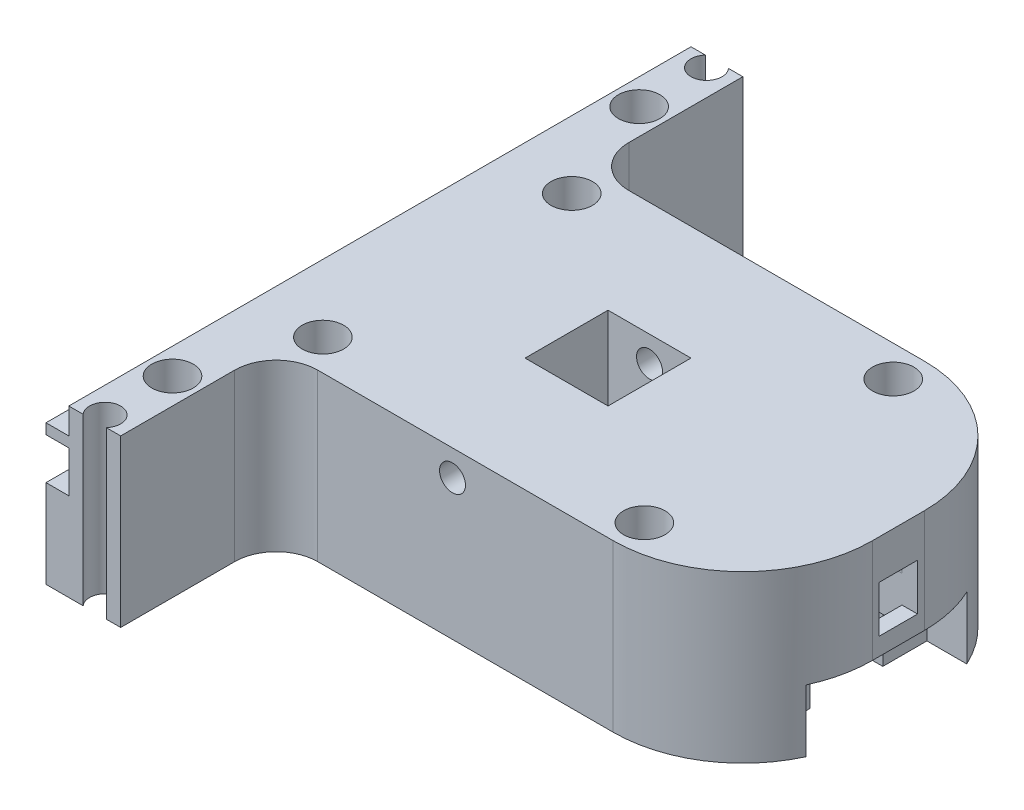
from build123d import *

# Parameters (mm, degrees)
SKETCH1_W           = 18.288
SKETCH1_H           = 40.64
BOSS_EXTRUDE1_DEPTH = 152.4
SKETCH2_W           = 5.588
SKETCH2_H           = 6.35
SKETCH2_H_2         = 10.16
CUT_EXTRUDE1_DEPTH  = 152.4
SKETCH3_R           = 5.08
CUT_EXTRUDE2_DEPTH  = 15.24
LPATTERN1_COUNT     = 4
LPATTERN1_PITCH     = 38.1
SKETCH4_R           = 2.032
CUT_EXTRUDE3_DEPTH  = 159.782305513
LPATTERN2_COUNT     = 4
LPATTERN2_PITCH     = 38.1
SKETCH5_W           = 76.2
SKETCH5_H           = 40.64
BOSS_EXTRUDE2_DEPTH = 114.3
SKETCH6_W           = 101.6
SKETCH6_H           = 76.2
BOSS_EXTRUDE3_DEPTH = 22.86
SKETCH8_R           = 3.81
CUT_EXTRUDE5_DEPTH  = 207.050836795
FILLET3_R           = 10.16
FILLET4_R           = 31.75
SKETCH16_W          = 76.2
SKETCH16_H          = 22.86
CUT_EXTRUDE13_DEPTH = 194.857086535
SKETCH18_W          = 20.32
SKETCH18_H          = 20.32
CUT_EXTRUDE14_DEPTH = 207.050836795
SKETCH19_W          = 39.37
SKETCH19_H          = 15.24
CUT_EXTRUDE15_DEPTH = 12.7
SKETCH20_W          = 38.1
SKETCH20_H          = 17.78
CUT_EXTRUDE16_DEPTH = 15.24
SKETCH21_W          = 13.97
SKETCH21_H          = 7.62
CUT_EXTRUDE17_DEPTH = 15.24
FILLET5_R           = 10.16
SKETCH22_W          = 9.398
SKETCH22_H          = 11.43
CUT_EXTRUDE18_DEPTH = 3.81
CUT_EXTRUDE19_DEPTH = 12.7
SKETCH25_W          = 9.398
SKETCH25_H          = 11.049
FILLET6_R           = 12.7
FILLET7_R           = 12.7
SKETCH26_R          = 5.08
CUT_EXTRUDE20_DEPTH = 15.24
SKETCH27_R          = 2.032
CUT_EXTRUDE21_DEPTH = 207.050836795
FILLET8_R           = 10.16
SKETCH29_R          = 3.175
CUT_EXTRUDE22_DEPTH = 180.70998134


with BuildPart() as part:
    # Sketch1 → Boss-Extrude1 (new body)
    with BuildSketch(Plane.XY):
        with Locations((9.144, 20.32)):
            Rectangle(SKETCH1_W, SKETCH1_H)
    extrude(amount=BOSS_EXTRUDE1_DEPTH)

    # Sketch2 → Cut-Extrude1 (cut)
    with BuildSketch(Plane(origin=(0, 0, 0), x_dir=(-1, 0, 0), z_dir=(0, 0, -1))):
        with Locations((-2.794, 37.465)):
            Rectangle(SKETCH2_W, SKETCH2_H)
        with Locations((-2.794, 26.67)):
            Rectangle(SKETCH2_W, SKETCH2_H_2)
    extrude(amount=-CUT_EXTRUDE1_DEPTH, mode=Mode.SUBTRACT)

    # Sketch3 → Cut-Extrude2 (cut)
    with BuildSketch(Plane(origin=(0, 40.64, 0), x_dir=(1, 0, 0), z_dir=(0, 1, 0))):
        with Locations(Location((11.938, -19.05, 0), (0, 0, 270))):
            Circle(SKETCH3_R)
    cut_extrude2 = extrude(amount=-CUT_EXTRUDE2_DEPTH, mode=Mode.SUBTRACT)

    # LPattern1: Cut-Extrude2 ×4, 2 skipped
    with Locations(*[(0, 0, i * LPATTERN1_PITCH) for i in range(1, LPATTERN1_COUNT) if i not in (1, 2)]):
        add(cut_extrude2, mode=Mode.SUBTRACT)

    # Sketch4 → Cut-Extrude3 (cut, through all)
    with BuildSketch(Plane(origin=(0, 40.64, 0), x_dir=(1, 0, 0), z_dir=(0, 1, 0))):
        with Locations(Location((11.938, -19.05, 0), (0, 0, 270))):
            Circle(SKETCH4_R)
    cut_extrude3 = extrude(amount=-CUT_EXTRUDE3_DEPTH, mode=Mode.SUBTRACT)

    # LPattern2: Cut-Extrude3 ×4, 2 skipped
    with Locations(*[(0, 0, i * LPATTERN2_PITCH) for i in range(1, LPATTERN2_COUNT) if i not in (1, 2)]):
        add(cut_extrude3, mode=Mode.SUBTRACT)

    # Sketch5 → Boss-Extrude2 (add)
    with BuildSketch(Plane(origin=(18.288, 0, 0), x_dir=(0, 0, -1), z_dir=(1, 0, 0))):
        with Locations((-76.2, 20.32)):
            Rectangle(SKETCH5_W, SKETCH5_H)
    extrude(amount=BOSS_EXTRUDE2_DEPTH)

    # Sketch6 → Boss-Extrude3 (add)
    with BuildSketch(Plane(origin=(0, 40.64, 0), x_dir=(1, 0, 0), z_dir=(0, 1, 0))):
        with Locations((81.788, -76.2)):
            Rectangle(SKETCH6_W, SKETCH6_H)
    extrude(amount=BOSS_EXTRUDE3_DEPTH)

    # Sketch8 → Cut-Extrude5 (cut, through all)
    with BuildSketch(Plane(origin=(0, 40.64, 0), x_dir=(1, 0, 0), z_dir=(0, 1, 0))):
        with Locations((11.938, -149.86)):
            Circle(SKETCH8_R)
        with Locations((11.938, -2.54)):
            Circle(SKETCH8_R)
    extrude(amount=-CUT_EXTRUDE5_DEPTH, mode=Mode.SUBTRACT)

    # Fillet3
    fillet3_edges = [part.edges().sort_by_distance(p)[0] for p in [
        (18.288, 20.32, 114.3),
        (18.288, 20.32, 38.1),
    ]]
    fillet(fillet3_edges, radius=FILLET3_R)

    # Fillet4
    fillet4_edges = [part.edges().sort_by_distance(p)[0] for p in [
        (132.588, 31.75, 114.3),
        (132.588, 31.75, 38.1),
    ]]
    fillet(fillet4_edges, radius=FILLET4_R)

    # Sketch16 → Cut-Extrude13 (cut, through all)
    with BuildSketch(Plane.ZY.offset(-30.988)):
        with Locations((76.2, 52.07)):
            Rectangle(SKETCH16_W, SKETCH16_H)
    extrude(amount=-CUT_EXTRUDE13_DEPTH, mode=Mode.SUBTRACT)

    # Sketch18 → Cut-Extrude14 (cut, through all)
    with BuildSketch(Plane(origin=(0, 40.64, 0), x_dir=(1, 0, 0), z_dir=(0, 1, 0))):
        with Locations((61.468, -76.2)):
            Rectangle(SKETCH18_W, SKETCH18_H)
    extrude(amount=-CUT_EXTRUDE14_DEPTH, mode=Mode.SUBTRACT)

    # Sketch19 → Cut-Extrude15 (cut)
    with BuildSketch(Plane(origin=(132.588, 0, 0), x_dir=(0, 0, -1), z_dir=(1, 0, 0))):
        with Locations((-76.2, 7.62)):
            Rectangle(SKETCH19_W, SKETCH19_H)
    extrude(amount=-CUT_EXTRUDE15_DEPTH, mode=Mode.SUBTRACT)

    # Sketch20 → Cut-Extrude16 (cut)
    with BuildSketch(Plane.XZ):
        with Locations((100.838, 76.2)):
            Rectangle(SKETCH20_W, SKETCH20_H)
    extrude(amount=-CUT_EXTRUDE16_DEPTH, mode=Mode.SUBTRACT)

    # Sketch21 → Cut-Extrude17 (cut)
    with BuildSketch(Plane.XZ):
        Polygon((0, 92.71), (81.788, 92.71), (95.758, 92.71), (95.758, 102.87), (0, 102.87), align=None)
        with Locations((88.773, 88.9)):
            Rectangle(SKETCH21_W, SKETCH21_H)
    extrude(amount=-CUT_EXTRUDE17_DEPTH, mode=Mode.SUBTRACT)

    # Fillet5
    fillet5_edges = [part.edges().sort_by_distance(p)[0] for p in [
        (81.788, 7.62, 67.31),
        (95.758, 7.62, 102.87),
        (81.788, 7.62, 92.71),
    ]]
    fillet(fillet5_edges, radius=FILLET5_R)

    # Sketch22 → Cut-Extrude18 (cut)
    with BuildSketch(Plane(origin=(132.588, 0, 0), x_dir=(0, 0, -1), z_dir=(1, 0, 0))):
        with Locations((-76.2, 25.273)):
            Rectangle(SKETCH22_W, SKETCH22_H)
    extrude(amount=-CUT_EXTRUDE18_DEPTH, mode=Mode.SUBTRACT)

    # Sketch23 → Cut-Extrude19 (cut)
    with BuildSketch(Plane(origin=(128.778, 0, 0), x_dir=(0, 0, -1), z_dir=(1, 0, 0))):
        with BuildLine():
            Line((-71.501, 19.558), (-71.501, 26.289))
            ThreePointArc((-71.501, 26.289), (-72.877305235, 22.966305235), (-76.2, 21.59))
            Line((-76.2, 21.59), (-76.2, 19.558))
            Line((-76.2, 19.558), (-71.501, 19.558))
        make_face()
        with BuildLine():
            ThreePointArc((-71.501, 26.289), (-72.877305235, 29.611694765), (-76.2, 30.988))
            Line((-76.2, 30.988), (-76.2, 26.289))
            Line((-76.2, 26.289), (-71.501, 26.289))
        make_face()
        with BuildLine():
            Line((-76.2, 26.289), (-76.2, 30.988))
            ThreePointArc((-76.2, 30.988), (-79.522694765, 29.611694765), (-80.899, 26.289))
            Line((-80.899, 26.289), (-76.2, 26.289))
        make_face()
        with BuildLine():
            Line((-71.501, 26.289), (-76.2, 26.289))
            Line((-76.2, 26.289), (-76.2, 21.59))
            ThreePointArc((-76.2, 21.59), (-72.877305235, 22.966305235), (-71.501, 26.289))
        make_face()
        with BuildLine():
            Line((-76.2, 21.59), (-76.2, 26.289))
            Line((-76.2, 26.289), (-80.899, 26.289))
            ThreePointArc((-80.899, 26.289), (-79.522694765, 22.966305235), (-76.2, 21.59))
        make_face()
        with BuildLine():
            ThreePointArc((-76.2, 21.59), (-79.522694765, 22.966305235), (-80.899, 26.289))
            Line((-80.899, 26.289), (-80.899, 19.558))
            Line((-80.899, 19.558), (-76.2, 19.558))
            Line((-76.2, 19.558), (-76.2, 21.59))
        make_face()
        Polygon((-71.501, 9.779), (-71.501, 19.558), (-76.2, 19.558), (-80.899, 19.558), (-80.899, 9.779), align=None)
    extrude(amount=-CUT_EXTRUDE19_DEPTH, mode=Mode.SUBTRACT)

    # Sketch25 → Cut-Revolve1 (revolve, cut)
    with BuildSketch(Plane(origin=(116.078, 0, 0), x_dir=(0, 0, -1), z_dir=(1, 0, 0))):
        with Locations((-76.2, 20.7645)):
            Rectangle(SKETCH25_W, SKETCH25_H)
    revolve(axis=Axis((116.078, 15.24, 80.899), (0, 0, -1)), mode=Mode.SUBTRACT)

    # Fillet6
    fillet6_edges = [part.edges().sort_by_distance(p)[0] for p in [
        (105.029, 15.24, 76.2),
    ]]
    fillet(fillet6_edges, radius=FILLET6_R)

    # Fillet7
    # the kernel refuses this fillet: 12.7 mm, written as the material it takes off along each edge
    with BuildSketch(Plane(origin=(0, 15.24, 102.87), x_dir=(1, 0, 0), z_dir=(0, 0, -1))) as fillet7_piece_1:
        with BuildLine():
            CenterArc((FILLET7_R, -FILLET7_R), FILLET7_R, 90, 90)
            Line((0, -FILLET7_R), (0, 0))
            Line((0, 0), (FILLET7_R, 0))
        make_face()
    extrude(amount=10.16, mode=Mode.SUBTRACT)
    with BuildSketch(Plane(origin=(0, -31.75, 92.71), x_dir=(0, 0, -1), z_dir=(0, 1, 0))) as fillet7_piece_2:
        with BuildLine():
            CenterArc((FILLET7_R, -FILLET7_R), FILLET7_R, 90, 90)
            Line((0, -FILLET7_R), (0, 0))
            Line((0, 0), (FILLET7_R, 0))
        make_face()
    extrude(amount=46.99, mode=Mode.SUBTRACT)
    with BuildSketch(Plane(origin=(0, -31.75, 102.87), x_dir=(0, 0, 1), z_dir=(0, 1, 0))) as fillet7_piece_3:
        with BuildLine():
            CenterArc((FILLET7_R, FILLET7_R), FILLET7_R, 180, 90)
            Line((0, FILLET7_R), (0, 0))
            Line((0, 0), (FILLET7_R, 0))
        make_face()
    extrude(amount=46.99, mode=Mode.SUBTRACT)
    with BuildSketch(Plane(origin=(0, 15.24, 134.62), x_dir=(1, 0, 0), z_dir=(0, 0, -1))) as fillet7_piece_4a_section:
        with BuildLine():
            CenterArc((FILLET7_R, -FILLET7_R), FILLET7_R, 90, 90)
            Line((0, -FILLET7_R), (0, 0))
            Line((0, 0), (FILLET7_R, 0))
        make_face()
    fillet7_piece_4a = extrude(amount=41.91, mode=Mode.PRIVATE)
    fillet7_piece_4a = split(fillet7_piece_4a, bisect_by=Plane(origin=(2.875217951, 18.115217951, 102.87), z_dir=(0, 0, 1)), keep=Keep.TOP, mode=Mode.PRIVATE)
    with BuildSketch(Plane(origin=(0, -31.75, 102.87), x_dir=(0, 0, 1), z_dir=(0, 1, 0))) as fillet7_piece_4b_section:
        with BuildLine():
            CenterArc((FILLET7_R, FILLET7_R), FILLET7_R, 180, 90)
            Line((0, FILLET7_R), (0, 0))
            Line((0, 0), (FILLET7_R, 0))
        make_face()
    fillet7_piece_4b = extrude(amount=78.74, mode=Mode.PRIVATE)
    fillet7_piece_4b = split(fillet7_piece_4b, bisect_by=Plane(origin=(2.875217951, 15.24, 105.745217951), z_dir=(0, 1, 0)), keep=Keep.TOP, mode=Mode.PRIVATE)
    fillet7_piece_4 = fillet7_piece_4a & fillet7_piece_4b
    add(fillet7_piece_4, mode=Mode.SUBTRACT)
    with BuildSketch(Plane(origin=(0, 15.24, 102.87), x_dir=(1, 0, 0), z_dir=(0, 0, -1))) as fillet7_piece_5a_section:
        with BuildLine():
            CenterArc((FILLET7_R, -FILLET7_R), FILLET7_R, 90, 90)
            Line((0, -FILLET7_R), (0, 0))
            Line((0, 0), (FILLET7_R, 0))
        make_face()
    fillet7_piece_5a = extrude(amount=41.91, mode=Mode.PRIVATE)
    fillet7_piece_5a = split(fillet7_piece_5a, bisect_by=Plane(origin=(2.875217951, 18.115217951, 92.71), z_dir=(0, 0, -1)), keep=Keep.TOP, mode=Mode.PRIVATE)
    with BuildSketch(Plane(origin=(0, -31.75, 92.71), x_dir=(0, 0, -1), z_dir=(0, 1, 0))) as fillet7_piece_5b_section:
        with BuildLine():
            CenterArc((FILLET7_R, -FILLET7_R), FILLET7_R, 90, 90)
            Line((0, -FILLET7_R), (0, 0))
            Line((0, 0), (FILLET7_R, 0))
        make_face()
    fillet7_piece_5b = extrude(amount=78.74, mode=Mode.PRIVATE)
    fillet7_piece_5b = split(fillet7_piece_5b, bisect_by=Plane(origin=(2.875217951, 15.24, 89.834782049), z_dir=(0, 1, 0)), keep=Keep.TOP, mode=Mode.PRIVATE)
    fillet7_piece_5 = fillet7_piece_5a & fillet7_piece_5b
    add(fillet7_piece_5, mode=Mode.SUBTRACT)

    # Sketch26 → Cut-Extrude20 (cut)
    with BuildSketch(Plane(origin=(0, 40.64, 0), x_dir=(1, 0, 0), z_dir=(0, 1, 0))):
        with Locations(Location((100.838, -106.68, 0), (0, 0, 270))):
            Circle(SKETCH26_R)
        with Locations(Location((100.838, -45.72, 0), (0, 0, 270))):
            Circle(SKETCH26_R)
    cut_extrude20 = extrude(amount=-CUT_EXTRUDE20_DEPTH, mode=Mode.SUBTRACT)

    # Sketch27 → Cut-Extrude21 (cut, through all)
    with BuildSketch(Plane(origin=(0, 40.64, 0), x_dir=(1, 0, 0), z_dir=(0, 1, 0))):
        with Locations(Location((100.838, -106.68, 0), (0, 0, 270))):
            Circle(SKETCH27_R)
        with Locations(Location((100.838, -45.72, 0), (0, 0, 270))):
            Circle(SKETCH27_R)
    cut_extrude21 = extrude(amount=-CUT_EXTRUDE21_DEPTH, mode=Mode.SUBTRACT)

    # Mirror1: Cut-Extrude20, Cut-Extrude21 across plane
    add(cut_extrude20.mirror(Plane.ZY.offset(-61.468)), mode=Mode.SUBTRACT)
    add(cut_extrude21.mirror(Plane.ZY.offset(-61.468)), mode=Mode.SUBTRACT)

    # Fillet8
    fillet8_edges = [part.edges().sort_by_distance(p)[0] for p in [
        (95.758, 7.62, 85.09),
    ]]
    fillet(fillet8_edges, radius=FILLET8_R)

    # Sketch29 → Cut-Extrude22 (cut, through all)
    with BuildSketch(Plane(origin=(0, 0, 38.1), x_dir=(-1, 0, 0), z_dir=(0, 0, -1))):
        with Locations((-61.468, 34.29)):
            Circle(SKETCH29_R)
    extrude(amount=-CUT_EXTRUDE22_DEPTH, mode=Mode.SUBTRACT)


solid = part.part
